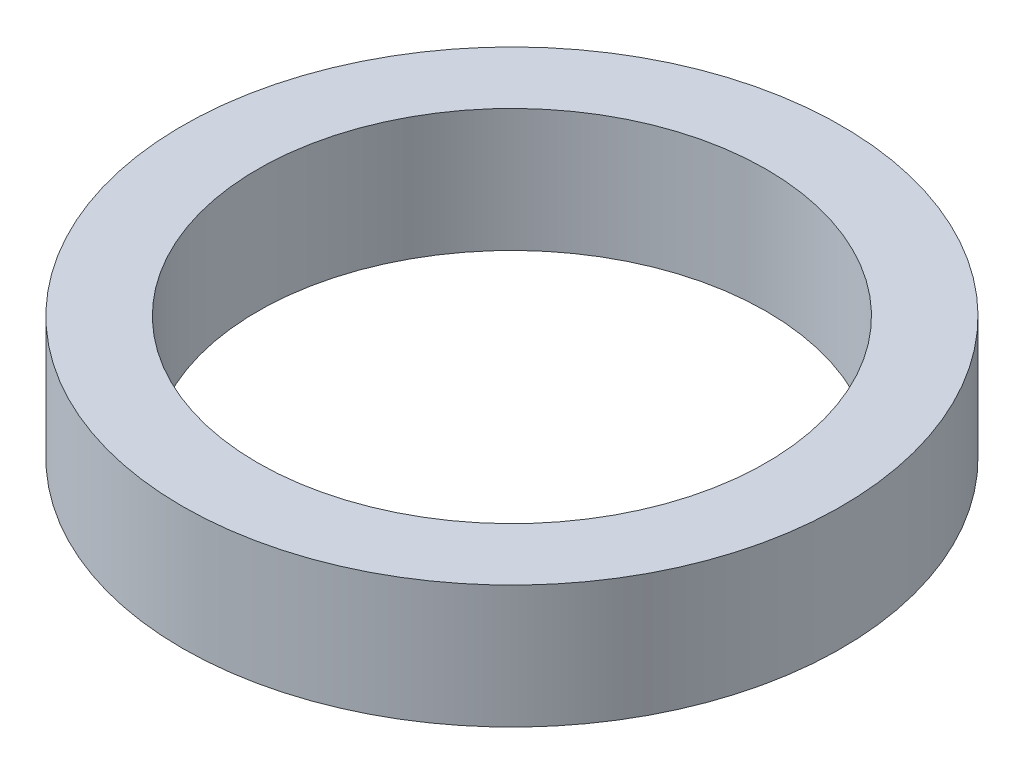
from build123d import *

# Parameters (mm, degrees)
SKETCH1_R           = 13.13
SKETCH1_R_2         = 10.13
BOSS_EXTRUDE1_DEPTH = 4.9


with BuildPart() as part:
    # Sketch1 → Boss-Extrude1 (new body)
    with BuildSketch(Plane(origin=(0, 0, 0), x_dir=(1, 0, 0), z_dir=(0, 1, 0))):
        Circle(SKETCH1_R)
        Circle(SKETCH1_R_2, mode=Mode.SUBTRACT)
    extrude(amount=BOSS_EXTRUDE1_DEPTH)


solid = part.part
